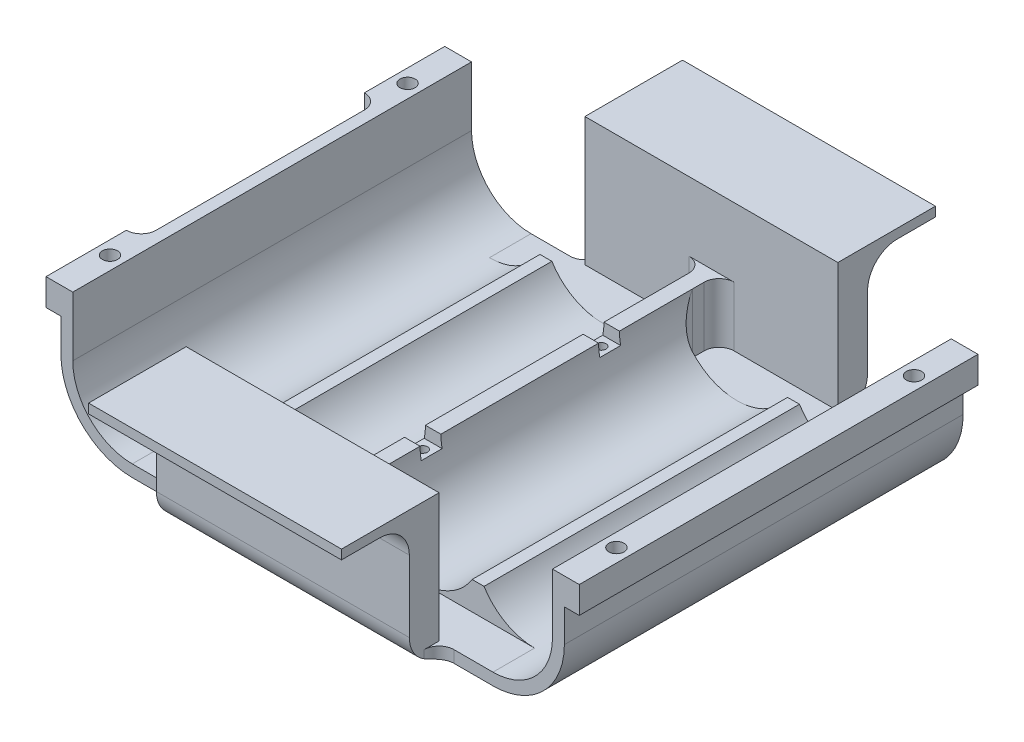
from build123d import *

# Parameters (mm, degrees)
BOSS_EXTRUDE1_DEPTH                       = 33.5
BOSS_EXTRUDE2_DEPTH                       = 21.25
FILLET3_R                                 = 5
CUT_EXTRUDE3_REACH                        = 106.891
SKETCH14_W                                = 2.5
SKETCH14_H                                = 40
M2X0_4_TAPPED_HOLE1_D                     = 1.6
TAPPED_HOLE_FOR_M2_5X0_45_HELICOIL1_D     = 2.55
TAPPED_HOLE_FOR_M2_5X0_45_HELICOIL1_DEPTH = 4.5
TAPPED_HOLE_FOR_M2_5X0_45_HELICOIL1_TIP   = 0.766097289
SKETCH22_W                                = 29
SKETCH22_H                                = 7
CUT_EXTRUDE4_DEPTH                        = 21.58
FILLET5_R                                 = 2.5
SKETCH23_W                                = 12.652347045
SKETCH23_H                                = 3.5
SKETCH23_W_2                              = 11.018435539
CUT_EXTRUDE5_DEPTH                        = 2


with BuildPart() as part:
    # Sketch1 → Boss-Extrude1 (new, symmetric)
    with BuildSketch(Plane.XY):
        with BuildLine():
            Line((0, 0), (4.5, 0))
            Line((4.5, 0), (4.5, -10))
            ThreePointArc((4.5, -10), (11.761387212, -19.617692031), (23, -15.267826876))
            Line((23, -15.267826876), (25, -15.267826876))
            ThreePointArc((25, -15.267826876), (36.238612788, -19.617692031), (43.5, -10))
            Line((43.5, -10), (46.1, -10))
            ThreePointArc((46.1, -10), (53.361387212, -19.617692031), (64.6, -15.267826876))
            Line((64.6, -15.267826876), (66.6, -15.267826876))
            ThreePointArc((66.6, -15.267826876), (77.838612788, -19.617692031), (85.1, -10))
            Line((85.1, -10), (85.1, 0))
            Line((85.1, 0), (89.6, 0))
            Line((89.6, 0), (89.6, -4.5))
            Line((89.6, -4.5), (87.1, -4.5))
            Line((87.1, -4.5), (87.1, -10))
            ThreePointArc((87.1, -10), (83.585281374, -18.485281374), (75.1, -22))
            Line((75.1, -22), (14.5, -22))
            ThreePointArc((14.5, -22), (6.014718626, -18.485281374), (2.5, -10))
            Line((2.5, -10), (2.5, -4.5))
            Line((2.5, -4.5), (0, -4.5))
            Line((0, -4.5), (0, 0))
        make_face()
    extrude(amount=BOSS_EXTRUDE1_DEPTH, both=True)

    # Sketch9 → Boss-Extrude2 (add, symmetric)
    with BuildSketch(Plane.ZY.offset(-44.8)):
        Polygon((33.5, -22), (38.5, -22), (38.5, 0), (49.9, 0), (49.9, 1.58), (33.5, 1.58), align=None)
    boss_extrude2 = extrude(amount=BOSS_EXTRUDE2_DEPTH, both=True)

    # Mirror1: Boss-Extrude2 across plane
    add(boss_extrude2.mirror(Plane.XY))

    # Fillet3
    fillet3_edges = [part.edges().sort_by_distance(p)[0] for p in [
        (44.8, -22, -38.5),
        (44.8, 0, -38.5),
        (44.8, 0, 38.5),
        (44.8, -22, 38.5),
    ]]
    fillet(fillet3_edges, radius=FILLET3_R)

    # Sketch14 → Cut-Extrude3 (cut, up to next)
    with BuildSketch(Plane(origin=(0, 0, 0), x_dir=(1, 0, 0), z_dir=(0, 1, 0)), mode=Mode.PRIVATE) as cut_extrude3_sk1:
        with Locations((1.25, 0)):
            Rectangle(SKETCH14_W, SKETCH14_H)
    cut_extrude3_tool1 = extrude(cut_extrude3_sk1.sketch, amount=-CUT_EXTRUDE3_REACH, mode=Mode.PRIVATE) & part.part
    add(cut_extrude3_tool1.solids().sort_by_distance((1.25, 0, 0))[0], mode=Mode.SUBTRACT)

    # M2x0.4 Tapped Hole1 (through all)
    with Locations(Plane(origin=(0, -10, 0), x_dir=(1, 0, 0), z_dir=(0, 1, 0))):
        with Locations((44.8, 15), (44.8, -15)):
            Hole(M2X0_4_TAPPED_HOLE1_D / 2)

    # Tapped Hole for M2.5x0.45 Helicoil1
    with Locations(Plane(origin=(0, 0, 0), x_dir=(1, 0, 0), z_dir=(0, 1, 0))):
        with Locations((2.25, 25), (2.25, -25), (87.35, -25), (87.35, 25)):
            Hole(TAPPED_HOLE_FOR_M2_5X0_45_HELICOIL1_D / 2, depth=TAPPED_HOLE_FOR_M2_5X0_45_HELICOIL1_DEPTH)
            with Locations((0, 0, -(TAPPED_HOLE_FOR_M2_5X0_45_HELICOIL1_DEPTH + TAPPED_HOLE_FOR_M2_5X0_45_HELICOIL1_TIP / 2))):  # 118° drill point
                Cone(0, TAPPED_HOLE_FOR_M2_5X0_45_HELICOIL1_D / 2, TAPPED_HOLE_FOR_M2_5X0_45_HELICOIL1_TIP, mode=Mode.SUBTRACT)

    # Sketch22 → Cut-Extrude4 (cut)
    with BuildSketch(Plane(origin=(0, 1.58, 0), x_dir=(1, 0, 0), z_dir=(0, 1, 0))):
        with Locations((29, 30)):
            Rectangle(SKETCH22_W, SKETCH22_H)
        with Locations((60.6, 30)):
            Rectangle(SKETCH22_W, SKETCH22_H)
        with Locations((29, -30)):
            Rectangle(SKETCH22_W, SKETCH22_H)
        with Locations((60.6, -30)):
            Rectangle(SKETCH22_W, SKETCH22_H)
    extrude(amount=-CUT_EXTRUDE4_DEPTH, mode=Mode.SUBTRACT)

    # Fillet5
    # the kernel refuses this fillet: 2.5 mm, written as the material it adds along each edge
    with BuildSketch(Plane(origin=(23.55, -20, -33.5), x_dir=(0, 0, -1), z_dir=(0, -1, 0))) as fillet5_piece_1_section:
        with BuildLine():
            CenterArc((FILLET5_R, -FILLET5_R), FILLET5_R, 90, 90)
            Line((0, -FILLET5_R), (0, 0))
            Line((0, 0), (FILLET5_R, 0))
        make_face()
    fillet5_piece_1 = extrude(amount=8.25, mode=Mode.PRIVATE)
    fillet5_piece_1 = fillet5_piece_1 & Plane(origin=(22.982039754, -17, -33.5), x_dir=(0, -1, 0), z_dir=(-1, 0, 0)) * Cylinder(5, 27, mode=Mode.PRIVATE)
    add(fillet5_piece_1)
    with BuildSketch(Plane(origin=(66.05, -20, -33.5), x_dir=(0, 0, -1), z_dir=(0, -1, 0))) as fillet5_piece_2_section:
        with BuildLine():
            CenterArc((FILLET5_R, FILLET5_R), FILLET5_R, 180, 90)
            Line((0, FILLET5_R), (0, 0))
            Line((0, 0), (FILLET5_R, 0))
        make_face()
    fillet5_piece_2 = extrude(amount=8.25, mode=Mode.PRIVATE)
    fillet5_piece_2 = fillet5_piece_2 & Plane(origin=(66.617960246, -17, -33.5), x_dir=(0, -1, 0), z_dir=(-1, 0, 0)) * Cylinder(5, 27, mode=Mode.PRIVATE)
    add(fillet5_piece_2)
    with BuildSketch(Plane(origin=(66.05, -20, 33.5), x_dir=(0, 0, 1), z_dir=(0, -1, 0))) as fillet5_piece_3_section:
        with BuildLine():
            CenterArc((FILLET5_R, -FILLET5_R), FILLET5_R, 90, 90)
            Line((0, -FILLET5_R), (0, 0))
            Line((0, 0), (FILLET5_R, 0))
        make_face()
    fillet5_piece_3 = extrude(amount=8.25, mode=Mode.PRIVATE)
    fillet5_piece_3 = fillet5_piece_3 & Plane(origin=(66.617960246, -17, 33.5), x_dir=(0, -1, 0), z_dir=(-1, 0, 0)) * Cylinder(5, 27, mode=Mode.PRIVATE)
    add(fillet5_piece_3)
    with BuildSketch(Plane(origin=(23.55, -20, 33.5), x_dir=(0, 0, 1), z_dir=(0, -1, 0))) as fillet5_piece_4_section:
        with BuildLine():
            CenterArc((FILLET5_R, FILLET5_R), FILLET5_R, 180, 90)
            Line((0, FILLET5_R), (0, 0))
            Line((0, 0), (FILLET5_R, 0))
        make_face()
    fillet5_piece_4 = extrude(amount=8.25, mode=Mode.PRIVATE)
    fillet5_piece_4 = fillet5_piece_4 & Plane(origin=(22.982039754, -17, 33.5), x_dir=(0, -1, 0), z_dir=(-1, 0, 0)) * Cylinder(5, 27, mode=Mode.PRIVATE)
    add(fillet5_piece_4)
    with BuildSketch(Plane(origin=(2.5, 0, 20), x_dir=(-1, 0, 0), z_dir=(0, -1, 0)), Plane(origin=(2.5, 0, -20), x_dir=(0, 0, 1), z_dir=(0, -1, 0))) as fillet5_piece_5:
        with BuildLine():
            CenterArc((FILLET5_R, FILLET5_R), FILLET5_R, 180, 90)
            Line((0, FILLET5_R), (0, 0))
            Line((0, 0), (FILLET5_R, 0))
        make_face()
    extrude(amount=4.5)
    with BuildSketch(Plane(origin=(43.5, -10, -26.5), x_dir=(-1, 0, 0), z_dir=(0, -1, 0))) as fillet5_piece_6_section:
        with BuildLine():
            CenterArc((FILLET5_R, FILLET5_R), FILLET5_R, 180, 90)
            Line((0, FILLET5_R), (0, 0))
            Line((0, 0), (FILLET5_R, 0))
        make_face()
    fillet5_piece_6 = extrude(amount=10, mode=Mode.PRIVATE)
    fillet5_piece_6 = fillet5_piece_6 - Plane(origin=(33.5, -10, -27.115850249), x_dir=(-0.8499999999999996, -0.5267826876426376, 0), z_dir=(0, 0, 1)) * Cylinder(10, 30, mode=Mode.PRIVATE)
    add(fillet5_piece_6)
    with BuildSketch(Plane(origin=(43.5, -10, -33.5), x_dir=(0, 0, 1), z_dir=(0, -1, 0)), Plane(origin=(43.5, -10, 33.5), x_dir=(-1, 0, 0), z_dir=(0, -1, 0))) as fillet5_piece_7:
        with BuildLine():
            CenterArc((FILLET5_R, FILLET5_R), FILLET5_R, 180, 90)
            Line((0, FILLET5_R), (0, 0))
            Line((0, 0), (FILLET5_R, 0))
        make_face()
    extrude(amount=10)
    with BuildSketch(Plane(origin=(43.5, -10, 26.5), x_dir=(-1, 0, 0), z_dir=(0, -1, 0))) as fillet5_piece_8_section:
        with BuildLine():
            CenterArc((FILLET5_R, -FILLET5_R), FILLET5_R, 90, 90)
            Line((0, -FILLET5_R), (0, 0))
            Line((0, 0), (FILLET5_R, 0))
        make_face()
    fillet5_piece_8 = extrude(amount=10, mode=Mode.PRIVATE)
    fillet5_piece_8 = fillet5_piece_8 - Plane(origin=(33.5, -10, 27.115850249), x_dir=(-0.8499999999999996, -0.5267826876426376, 0), z_dir=(0, 0, 1)) * Cylinder(10, 30, mode=Mode.PRIVATE)
    add(fillet5_piece_8)
    with BuildSketch(Plane(origin=(46.1, -10, 33.5), x_dir=(1, 0, 0), z_dir=(0, -1, 0)), Plane(origin=(46.1, -10, -33.5), x_dir=(0, 0, 1), z_dir=(0, -1, 0))) as fillet5_piece_9:
        with BuildLine():
            CenterArc((FILLET5_R, -FILLET5_R), FILLET5_R, 90, 90)
            Line((0, -FILLET5_R), (0, 0))
            Line((0, 0), (FILLET5_R, 0))
        make_face()
    extrude(amount=10)
    with BuildSketch(Plane(origin=(46.1, -10, 26.5), x_dir=(1, 0, 0), z_dir=(0, -1, 0))) as fillet5_piece_10_section:
        with BuildLine():
            CenterArc((FILLET5_R, FILLET5_R), FILLET5_R, 180, 90)
            Line((0, FILLET5_R), (0, 0))
            Line((0, 0), (FILLET5_R, 0))
        make_face()
    fillet5_piece_10 = extrude(amount=10, mode=Mode.PRIVATE)
    fillet5_piece_10 = fillet5_piece_10 - Plane(origin=(56.1, -10, 27.115850543), x_dir=(-1, 0, 0), z_dir=(0, 0, 1)) * Cylinder(10, 30, mode=Mode.PRIVATE)
    add(fillet5_piece_10)
    with BuildSketch(Plane(origin=(46.1, -10, -26.5), x_dir=(1, 0, 0), z_dir=(0, -1, 0))) as fillet5_piece_11_section:
        with BuildLine():
            CenterArc((FILLET5_R, -FILLET5_R), FILLET5_R, 90, 90)
            Line((0, -FILLET5_R), (0, 0))
            Line((0, 0), (FILLET5_R, 0))
        make_face()
    fillet5_piece_11 = extrude(amount=10, mode=Mode.PRIVATE)
    fillet5_piece_11 = fillet5_piece_11 - Plane(origin=(56.1, -10, -27.115850543), x_dir=(-1, 0, 0), z_dir=(0, 0, 1)) * Cylinder(10, 30, mode=Mode.PRIVATE)
    add(fillet5_piece_11)

    # Sketch23 → Cut-Extrude5 (cut)
    with BuildSketch(Plane(origin=(0, -10, 0), x_dir=(1, 0, 0), z_dir=(0, 1, 0))):
        with Locations((44.873232105, 15)):
            Rectangle(SKETCH23_W, SKETCH23_H)
        with Locations((44.351234715, -15)):
            Rectangle(SKETCH23_W_2, SKETCH23_H)
    extrude(amount=-CUT_EXTRUDE5_DEPTH, mode=Mode.SUBTRACT)


solid = part.part
